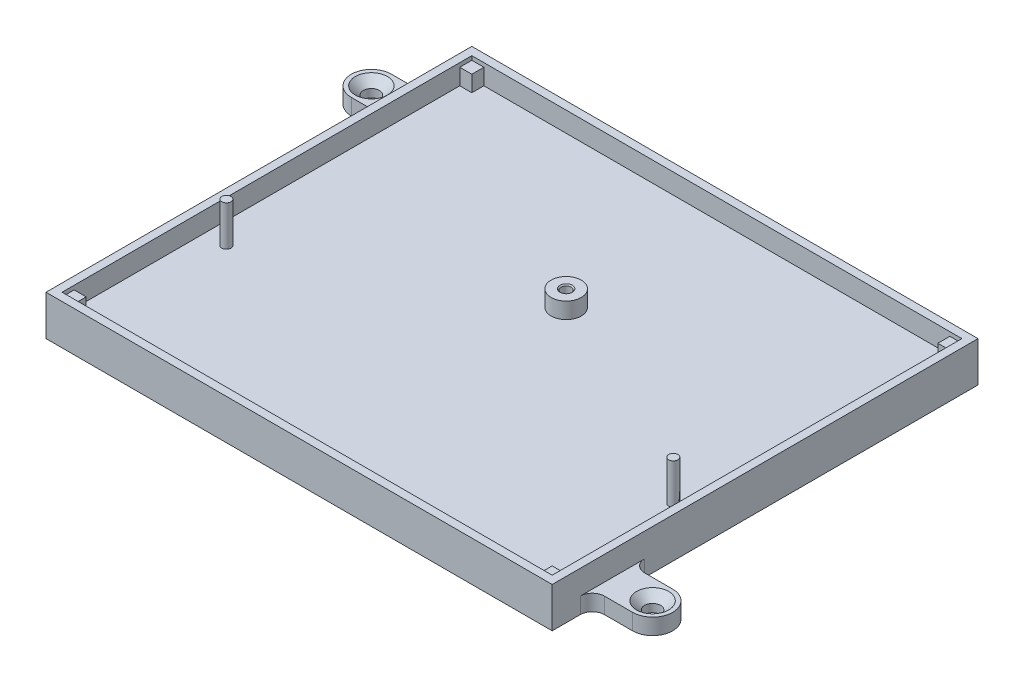
from build123d import *

# Parameters (mm, degrees)
SKETCH1_W                       = 126
SKETCH1_H                       = 106
BOSS_EXTRUDE1_DEPTH             = 5
SKETCH3_W                       = 126
SKETCH3_H                       = 106
SKETCH3_W_2                     = 122
SKETCH3_H_2                     = 102
BOSS_EXTRUDE3_DEPTH             = 5
BOSS_EXTRUDE5_DEPTH             = 4
FILLET1_R                       = 3
F_4_0MM_DOWEL_HOLE1_D           = 4
F_4_0MM_DOWEL_HOLE1_CSINK_D     = 8
F_4_0MM_DOWEL_HOLE1_CSINK_ANGLE = 90
SKETCH17_R                      = 1.15
BOSS_EXTRUDE6_DEPTH             = 10
SKETCH18_W                      = 3
SKETCH18_H                      = 3
BOSS_EXTRUDE7_DEPTH             = 4
SKETCH4_R                       = 3.75
BOSS_EXTRUDE8_DEPTH             = 4
M3_TAPPED_HOLE1_D               = 2.5
M3_TAPPED_HOLE1_CSINK_D         = 3.05
M3_TAPPED_HOLE1_CSINK_ANGLE     = 90


with BuildPart() as part:
    # Sketch1 → Boss-Extrude1 (new body)
    with BuildSketch(Plane(origin=(0, 0, 0), x_dir=(1, 0, 0), z_dir=(0, 1, 0))):
        Rectangle(SKETCH1_W, SKETCH1_H)
    extrude(amount=BOSS_EXTRUDE1_DEPTH)

    # Sketch3 → Boss-Extrude3 (add)
    with BuildSketch(Plane(origin=(0, 5, 0), x_dir=(1, 0, 0), z_dir=(0, 1, 0))):
        Rectangle(SKETCH3_W, SKETCH3_H)
        Rectangle(SKETCH3_W_2, SKETCH3_H_2, mode=Mode.SUBTRACT)
    extrude(amount=BOSS_EXTRUDE3_DEPTH)

    # Sketch7 → Boss-Extrude5 (add)
    with BuildSketch(Plane(origin=(0, 0, 0), x_dir=(1, 0, 0), z_dir=(0, 1, 0))):
        with BuildLine():
            Line((-63, 43), (-73, 43))
            ThreePointArc((-73, 43), (-78, 38), (-73, 33))
            Line((-73, 33), (-63, 33))
            Line((-63, 33), (-63, 43))
        make_face()
        with BuildLine():
            Line((63, -33), (73, -33))
            ThreePointArc((73, -33), (78, -38), (73, -43))
            Line((73, -43), (63, -43))
            Line((63, -43), (63, -33))
        make_face()
    extrude(amount=BOSS_EXTRUDE5_DEPTH)

    # Fillet1
    fillet1_edges = [part.edges().sort_by_distance(p)[0] for p in [
        (-63, 2, -33),
        (-63, 2, -43),
        (63, 2, 43),
        (63, 2, 33),
    ]]
    fillet(fillet1_edges, radius=FILLET1_R)

    # Ø4.0mm Dowel Hole1 (through all)
    with Locations(Plane(origin=(0, 4, 0), x_dir=(1, 0, 0), z_dir=(0, 1, 0))):
        with Locations((-73, 38), (73, -38)):
            CounterSinkHole(F_4_0MM_DOWEL_HOLE1_D / 2, F_4_0MM_DOWEL_HOLE1_CSINK_D / 2, counter_sink_angle=F_4_0MM_DOWEL_HOLE1_CSINK_ANGLE)

    # Sketch17 → Boss-Extrude6 (add)
    with BuildSketch(Plane(origin=(0, 5, 0), x_dir=(1, 0, 0), z_dir=(0, 1, 0))):
        with Locations((-55.626, -15.47)):
            Circle(SKETCH17_R)
        with Locations((55.626, -15.47)):
            Circle(SKETCH17_R)
    extrude(amount=BOSS_EXTRUDE6_DEPTH)

    # Sketch18 → Boss-Extrude7 (add)
    with BuildSketch(Plane(origin=(0, 5, 0), x_dir=(1, 0, 0), z_dir=(0, 1, 0))):
        with Locations((-59.5, 49.5)):
            Rectangle(SKETCH18_W, SKETCH18_H)
        with Locations((59.5, 49.5)):
            Rectangle(SKETCH18_W, SKETCH18_H)
        with Locations((-59.5, -49.5)):
            Rectangle(SKETCH18_W, SKETCH18_H)
        with Locations((59.5, -49.5)):
            Rectangle(SKETCH18_W, SKETCH18_H)
    extrude(amount=BOSS_EXTRUDE7_DEPTH)

    # Sketch4 → Boss-Extrude8 (add)
    with BuildSketch(Plane(origin=(0, 5, 0), x_dir=(1, 0, 0), z_dir=(0, 1, 0))):
        with Locations((0, 13.486)):
            Circle(SKETCH4_R)
    extrude(amount=BOSS_EXTRUDE8_DEPTH)

    # M3 Tapped Hole1 (through all)
    with Locations(Plane(origin=(0, 9, 0), x_dir=(1, 0, 0), z_dir=(0, 1, 0))):
        with Locations((0, 13.486)):
            CounterSinkHole(M3_TAPPED_HOLE1_D / 2, M3_TAPPED_HOLE1_CSINK_D / 2, counter_sink_angle=M3_TAPPED_HOLE1_CSINK_ANGLE)


solid = part.part
